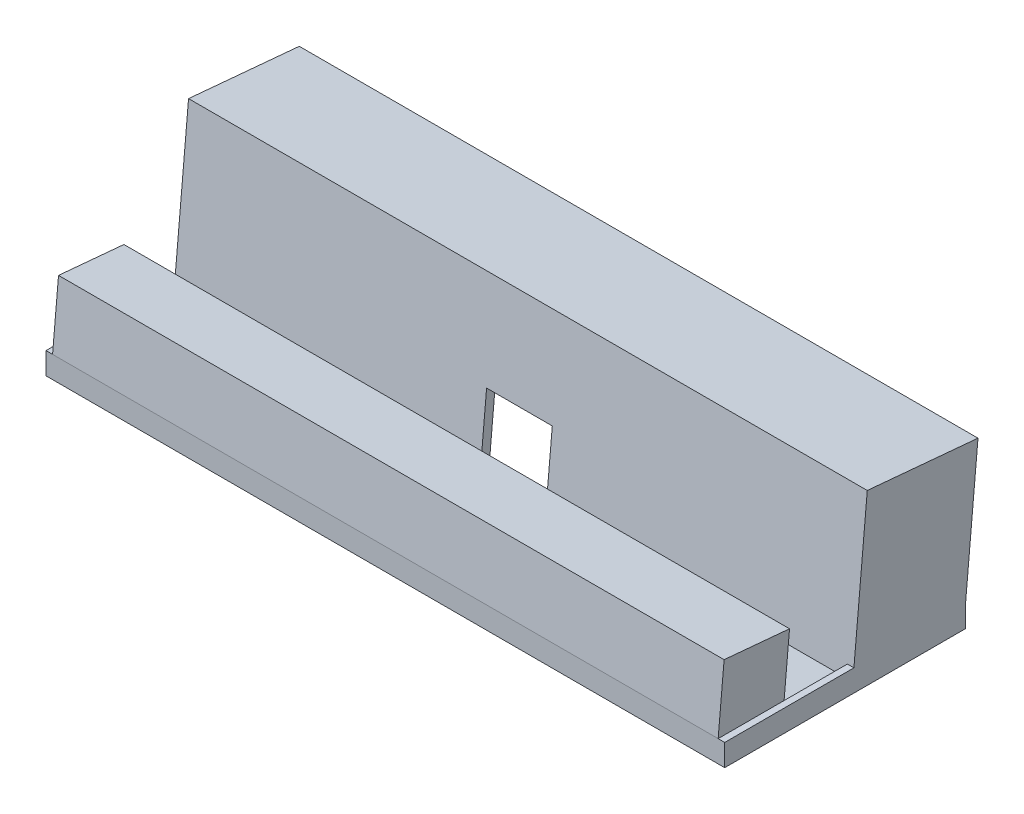
from build123d import *

# Parameters (mm, degrees)
SKETCH1_W           = 155
SKETCH1_H           = 55
BOSS_EXTRUDE1_DEPTH = 5
SKETCH2_W           = 152
SKETCH2_H           = 14.382798891
CUT_EXTRUDE1_DEPTH  = 5
BOSS_EXTRUDE2_START = -25.391327
SKETCH3_W           = 155
SKETCH3_H           = 35
BOSS_EXTRUDE2_DEPTH = 25.391327
SHELL2_START        = -75.5
SHELL2_DEPTH        = 151
SKETCH4_W           = 152
SKETCH4_H           = 15
BOSS_EXTRUDE3_DEPTH = 15
CUT_EXTRUDE2_REACH  = 93.36
SKETCH6_W           = 15
SKETCH6_H           = 15
SKETCH7_R           = 7.5
CUT_EXTRUDE3_DEPTH  = 2


# Read off the part's stored shape, not the designer's step: Shell2
with BuildPart() as part:
    # Sketch1 → Boss-Extrude1 (new body)
    with BuildSketch(Plane(origin=(0, 0, 0), x_dir=(1, 0, 0), z_dir=(0, 1, 0))):
        Rectangle(SKETCH1_W, SKETCH1_H)
    extrude(amount=BOSS_EXTRUDE1_DEPTH)

    # Sketch2 → Cut-Extrude1 (cut)
    with BuildSketch(Plane(origin=(0, 2.479508197, -0.225409836), x_dir=(1, 0, 0), z_dir=(0, 0.995893206467704, -0.09053574604251854))):
        with Locations((0, -5.648342463)):
            Rectangle(SKETCH2_W, SKETCH2_H)
    extrude(amount=CUT_EXTRUDE1_DEPTH, mode=Mode.SUBTRACT)

    # Sketch3 → Boss-Extrude2 (add)
    with BuildSketch(Plane(origin=(0, -0.139701815, -1.536719966), x_dir=(1, 0, 0), z_dir=(0, 0.09053574604251854, 0.995893206467704)).offset(BOSS_EXTRUDE2_START)):
        with Locations((0, 21.35336938)):
            Rectangle(SKETCH3_W, SKETCH3_H)
    extrude(amount=BOSS_EXTRUDE2_DEPTH)

    # Shell2 outline → Shell2 (cut)
    with BuildSketch(Plane.YZ.offset(SHELL2_START)):
        Polygon((0.166948477, -3.572844723), (1.831248889, 14.734459808), (3, 14.628209707), (3, 25.5), (0, 25.5), (0, -25.5), (5.090722034, -25.5), (34.444567103, -28.16853137), (36.381246894, -6.86505367), align=None)
    extrude(amount=SHELL2_DEPTH, mode=Mode.SUBTRACT)

    # Sketch4 → Boss-Extrude3 (add)
    with BuildSketch(Plane(origin=(0, 1.162455613, 12.787011739), x_dir=(-1, 0, 0), z_dir=(0, -0.09053574604251854, -0.995893206467704))):
        with Locations((0, 9.989733016)):
            Rectangle(SKETCH4_W, SKETCH4_H)
    extrude(amount=-BOSS_EXTRUDE3_DEPTH)

    # Sketch6 → Cut-Extrude2 (cut, up to next)
    with BuildSketch(Plane(origin=(0, -0.139701815, -1.536719966), x_dir=(1, 0, 0), z_dir=(0, 0.09053574604251854, 0.995893206467704)), mode=Mode.PRIVATE) as cut_extrude2_sk1:
        with Locations((0, 9.989733016)):
            Rectangle(SKETCH6_W, SKETCH6_H)
    cut_extrude2_tool1 = extrude(cut_extrude2_sk1.sketch, amount=-CUT_EXTRUDE2_REACH, mode=Mode.PRIVATE) & part.part
    add(cut_extrude2_tool1.solids().sort_by_distance((0, 9.809005, -2.441148))[0], mode=Mode.SUBTRACT)

    # Sketch7 → Cut-Extrude3 (cut)
    with BuildSketch(Plane.ZY.offset(77.5)):
        with Locations((-13.406777373, 25.5)):
            Circle(SKETCH7_R)
    extrude(amount=-CUT_EXTRUDE3_DEPTH, mode=Mode.SUBTRACT)


solid = part.part
